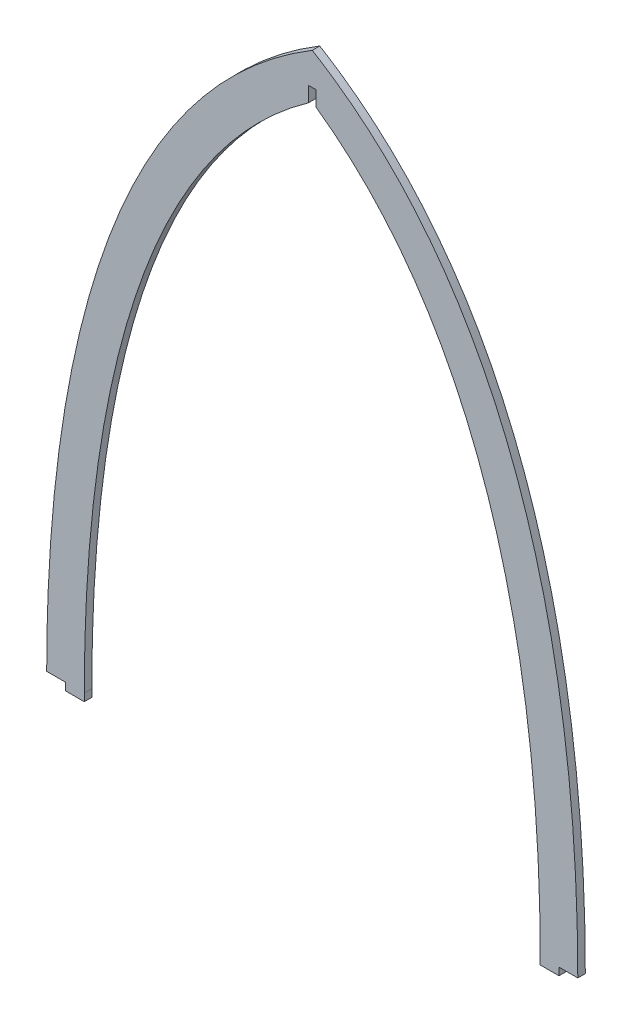
from build123d import *

# Parameters (mm, degrees)
BOSS_EXTRUDE1_DEPTH = 1.5


with BuildPart() as part:
    # Sketch1 → Boss-Extrude1 (new, symmetric)
    with BuildSketch(Plane.XY):
        with BuildLine():
            Line((-106, 162), (-98.5, 162))
            Line((-98.5, 162), (-98.5, 159))
            Line((-98.5, 159), (-91, 159))
            Line((-91, 159), (-91, 162))
            add(Edge.make_bspline(
                [(-91, 162), (-91, 163.331524141), (-90.992376318, 165.983870931), (-90.945171024, 171.374041262), (-90.823504223, 178.205929247), (-90.568516042, 186.555758505), (-90.071645038, 197.860045048), (-89.134789291, 212.26907526), (-87.43709218, 229.859021299), (-85.098976262, 247.601905442), (-81.040866449, 271.26711415), (-74.045466816, 300.495547841), (-62.102149991, 333.833287872), (-48.848124705, 359.221840008), (-36.073317005, 377.590452103), (-25.355695414, 390.287212667), (-15.418026325, 399.891290702), (-7.305039618, 406.550984174), (-3.288780832, 409.527699977), (-1.5, 410.793822053)],
                knots=[0, 0, 0, 0, 0.015112969, 0.030225939, 0.060451877, 0.090677816, 0.120903754, 0.181355631, 0.241807508, 0.302259385, 0.362711262, 0.483615016, 0.60451877, 0.725422524, 0.785874401, 0.846326278, 0.906778155, 0.937004094, 0.960647293, 0.960647293, 0.960647293, 0.960647293], degree=3))
            Line((-1.5, 410.793822053), (-1.5, 416.841652361))
            Line((-1.5, 416.841652361), (1.5, 416.841652361))
            Line((1.5, 416.841652361), (1.5, 410.793822053))
            add(Edge.make_bspline(
                [(1.5, 410.793822053), (3.288780832, 409.527699977), (7.305039618, 406.550984174), (15.418026325, 399.891290702), (25.355695414, 390.287212667), (36.073317005, 377.590452103), (48.848124705, 359.221840008), (62.102149991, 333.833287872), (74.045466816, 300.495547841), (81.040866449, 271.26711415), (85.098976262, 247.601905442), (87.43709218, 229.859021299), (89.134789291, 212.26907526), (90.071645038, 197.860045048), (90.568516042, 186.555758505), (90.823504223, 178.205929247), (90.945171024, 171.374041262), (90.992376318, 165.983870931), (91, 163.331524141), (91, 162)],
                knots=[0.00658274, 0.00658274, 0.00658274, 0.00658274, 0.030225939, 0.060451877, 0.120903754, 0.181355631, 0.241807508, 0.362711262, 0.483615016, 0.60451877, 0.664970647, 0.725422524, 0.785874401, 0.846326278, 0.876552217, 0.906778155, 0.937004094, 0.952117063, 0.967230032, 0.967230032, 0.967230032, 0.967230032], degree=3))
            Line((91, 162), (91, 159))
            Line((91, 159), (98.5, 159))
            Line((98.5, 159), (98.5, 162))
            Line((98.5, 162), (106, 162))
            add(Edge.make_bspline(
                [(106, 162), (106, 251.51123923), (88.948086668, 376.101025723), (0, 429.683378347)],
                knots=[0, 0, 0, 0, 1, 1, 1, 1], degree=3))
            add(Edge.make_bspline(
                [(-106, 162), (-106, 251.51123923), (-88.948086668, 376.101025723), (0, 429.683378347)],
                knots=[0, 0, 0, 0, 1, 1, 1, 1], degree=3))
        make_face()
    extrude(amount=BOSS_EXTRUDE1_DEPTH, both=True)


solid = part.part
